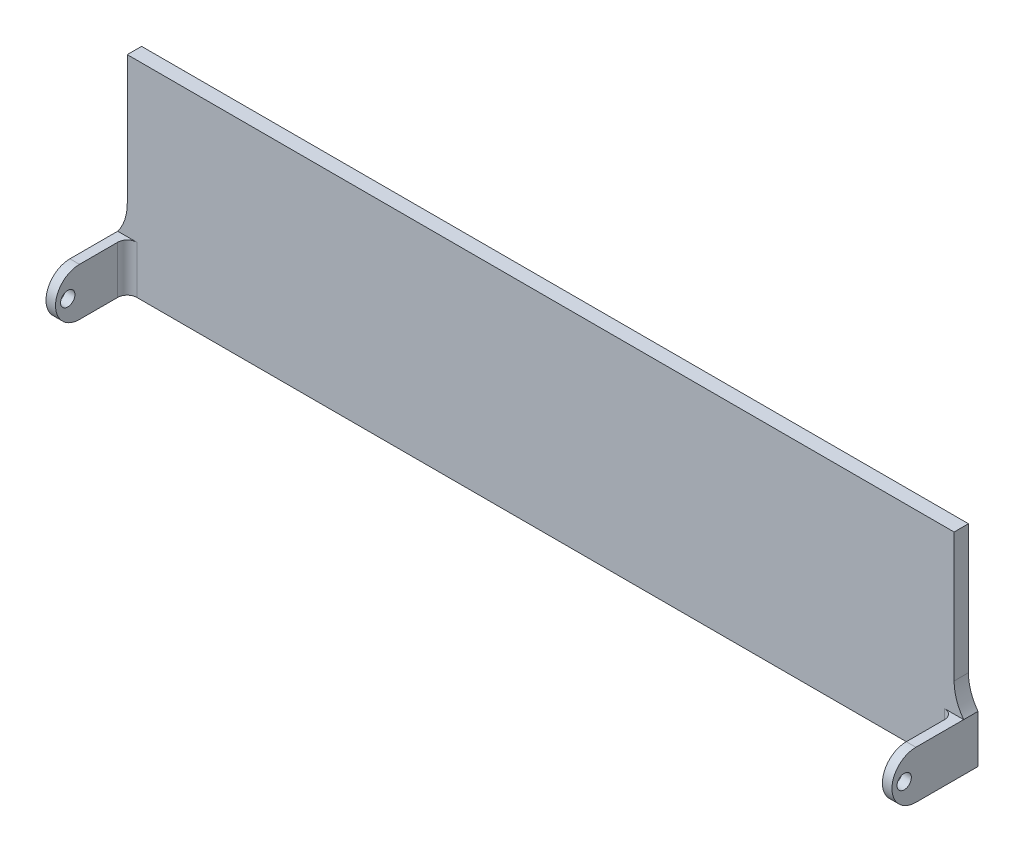
from build123d import *

# Parameters (mm, degrees)
SKETCH1_W           = 173
SKETCH1_H           = 43
BOSS_EXTRUDE1_DEPTH = 3
SKETCH2_R           = 5
SKETCH2_W           = 13
SKETCH2_H           = 10
BOSS_EXTRUDE2_DEPTH = 2
BOSS_EXTRUDE3_START = 2
SKETCH3_R           = 5
SKETCH3_W           = 13
SKETCH3_H           = 10
BOSS_EXTRUDE3_DEPTH = 2
SKETCH4_R           = 1.5
CUT_EXTRUDE1_DEPTH  = 200
FILLET1_R           = 10
FILLET2_R           = 2


with BuildPart() as part:
    # Sketch1 → Boss-Extrude1 (new body)
    with BuildSketch(Plane.XY):
        Rectangle(SKETCH1_W, SKETCH1_H)
    extrude(amount=BOSS_EXTRUDE1_DEPTH)

    # Sketch2 → Boss-Extrude2 (add)
    with BuildSketch(Plane.ZY.offset(86.5)):
        with Locations((13, -16.5)):
            Circle(SKETCH2_R)
        with Locations((6.5, -16.5)):
            Rectangle(SKETCH2_W, SKETCH2_H)
    extrude(amount=BOSS_EXTRUDE2_DEPTH)

    # Sketch3 → Boss-Extrude3 (add)
    with BuildSketch(Plane(origin=(86.5, 0, 0), x_dir=(0, 0, -1), z_dir=(1, 0, 0)).offset(BOSS_EXTRUDE3_START)):
        with Locations((-13, -16.5)):
            Circle(SKETCH3_R)
        with Locations((-6.5, -16.5)):
            Rectangle(SKETCH3_W, SKETCH3_H)
    extrude(amount=-BOSS_EXTRUDE3_DEPTH)

    # Sketch4 → Cut-Extrude1 (cut)
    with BuildSketch(Plane(origin=(88.5, 0, 0), x_dir=(0, 0, -1), z_dir=(1, 0, 0))):
        with Locations((-15.446473159, -16.5)):
            Circle(SKETCH4_R)
    extrude(amount=-CUT_EXTRUDE1_DEPTH, mode=Mode.SUBTRACT)

    # Fillet1
    # the kernel refuses this fillet: 10 mm, written as the material it adds along each edge
    with BuildSketch(Plane(origin=(-86.5, -11.5, 3), x_dir=(0, 1, 0), z_dir=(0, 0, -1))) as fillet1_piece_1:
        with BuildLine():
            CenterArc((6, -10), FILLET1_R, 90, 36.869897646)
            Line((0, -2), (0, 0))
            Line((0, 0), (6, 0))
        make_face()
    extrude(amount=3)
    with BuildSketch(Plane(origin=(86.5, -11.5, 3), x_dir=(0, 1, 0), z_dir=(0, 0, -1))) as fillet1_piece_2:
        with BuildLine():
            CenterArc((6, 10), FILLET1_R, 233.130102354, 36.869897646)
            Line((0, 2), (0, 0))
            Line((0, 0), (6, 0))
        make_face()
    extrude(amount=3)

    # Fillet2
    fillet2_edges = [part.edges().sort_by_distance(p)[0] for p in [
        (-86.5, -16.5, 3),
        (86.5, -16.5, 3),
    ]]
    fillet(fillet2_edges, radius=FILLET2_R)


solid = part.part
